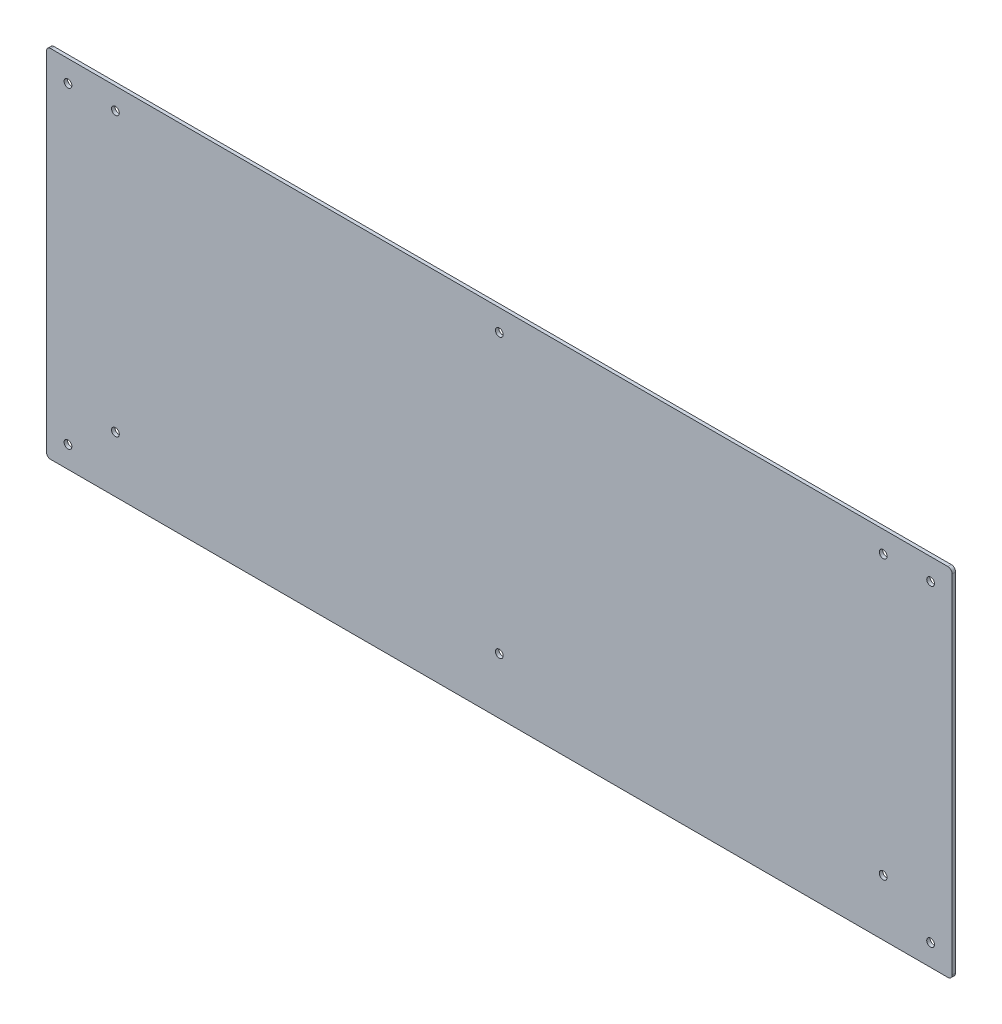
from build123d import *

# Parameters (mm, degrees)
SKETCH1_W            = 420
SKETCH1_H            = 165
BASE_FLANGE1_DEPTH   = 1.588
BREAK_CORNER1_START  = -1.588
BREAK_CORNER1_DEPTH  = 1.588
M3_CLEARANCE_HOLE1_D = 3.6


# Read off the part's stored shape, not the designer's step: Break-Corner1
# Sheet-metal steps are written as plain solids
with BuildPart() as part:
    # Sketch1 → Base-Flange1 (new body)
    with BuildSketch(Plane.XY):
        Rectangle(SKETCH1_W, SKETCH1_H)
    extrude(amount=-BASE_FLANGE1_DEPTH)

    # Break-Corner1 outline → Break-Corner1 (cut)
    with BuildSketch(Plane.XY.offset(BREAK_CORNER1_START)):
        with BuildLine():
            ThreePointArc((208, 82.5), (209.414213562, 81.914213562), (210, 80.5))
            Line((210, 80.5), (210, 82.5))
            Line((210, 82.5), (208, 82.5))
        make_face()
        with BuildLine():
            Line((210, -82.5), (210, -80.5))
            ThreePointArc((210, -80.5), (209.414213562, -81.914213562), (208, -82.5))
            Line((208, -82.5), (210, -82.5))
        make_face()
        with BuildLine():
            ThreePointArc((-210, 80.5), (-209.414213562, 81.914213562), (-208, 82.5))
            Line((-208, 82.5), (-210, 82.5))
            Line((-210, 82.5), (-210, 80.5))
        make_face()
        with BuildLine():
            Line((-210, -82.5), (-208, -82.5))
            ThreePointArc((-208, -82.5), (-209.414213562, -81.914213562), (-210, -80.5))
            Line((-210, -80.5), (-210, -82.5))
        make_face()
    extrude(amount=BREAK_CORNER1_DEPTH, mode=Mode.SUBTRACT)

    # M3 Clearance Hole1 (through all)
    with Locations(Plane.XY):
        with Locations((-200, 72.5), (-178, 72.5), (0, 72.5), (0, -56.5), (-178, -56.5), (-200, -72.5)):
            m3_clearance_hole1 = Hole(M3_CLEARANCE_HOLE1_D / 2)

    # Mirror3: M3 Clearance Hole1 across plane
    add(m3_clearance_hole1.mirror(Plane(origin=(0, 0, 0), x_dir=(0, 0, 1), z_dir=(1, 0, 0))), mode=Mode.SUBTRACT)


solid = part.part
